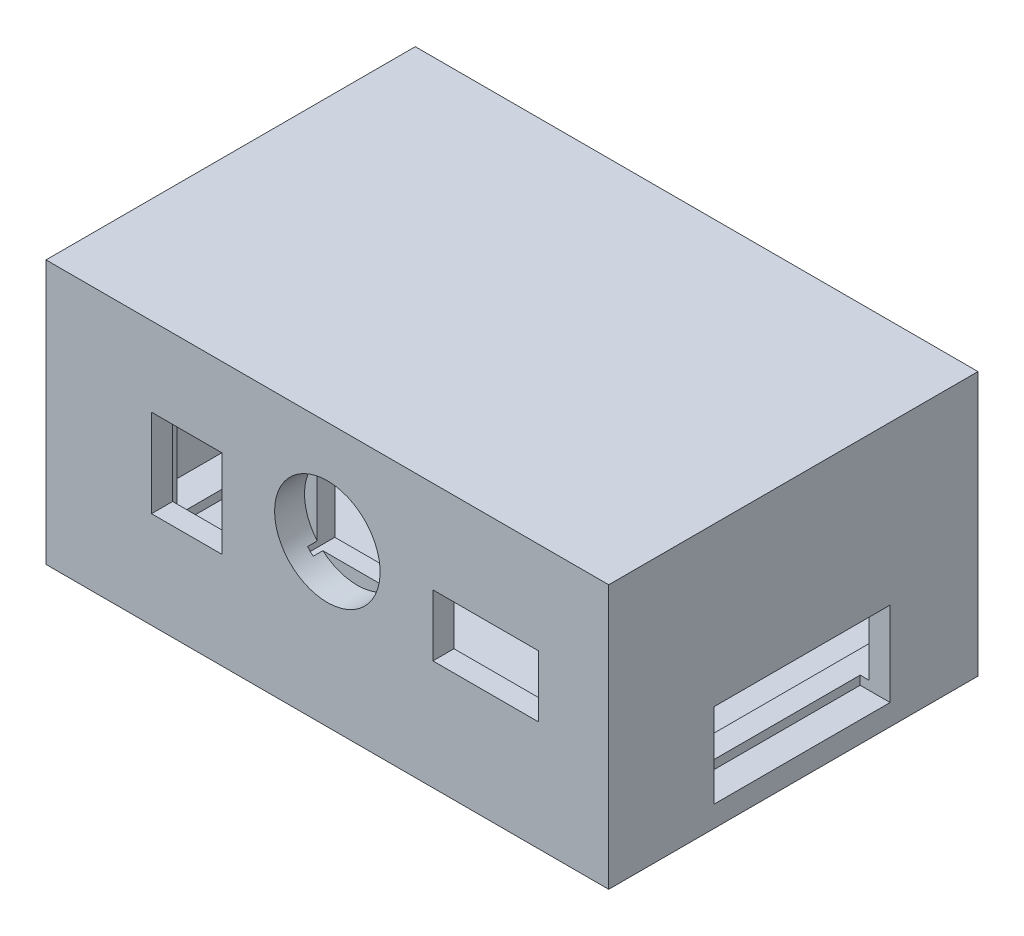
from build123d import *

# Parameters (mm, degrees)
BOSS_EXTRUDE1_START  = 80
SKETCH1_W            = 64
SKETCH1_H            = 30
BOSS_EXTRUDE1_DEPTH  = 42
BOSS_EXTRUDE2_START  = 79
SKETCH2_W            = 59.2
SKETCH2_H            = 25.2
BOSS_EXTRUDE2_DEPTH  = 40.6
BOSS_EXTRUDE3_START  = 80
SKETCH3_W            = 64
SKETCH3_H            = 10
BOSS_EXTRUDE3_DEPTH  = 2.4
BOSS_EXTRUDE4_START  = 80
SKETCH4_W            = 7.8
SKETCH4_H            = 11.6
BOSS_EXTRUDE4_DEPTH  = 6
BOSS_EXTRUDE5_START  = 79
SKETCH5_R            = 1
BOSS_EXTRUDE5_DEPTH  = 8
BOSS_EXTRUDE6_START  = 79
SKETCH6_R            = 1
BOSS_EXTRUDE6_DEPTH  = 8
BOSS_EXTRUDE7_START  = 80
SKETCH7_W            = 7.8
SKETCH7_H            = 11.6
BOSS_EXTRUDE7_DEPTH  = 6
BOSS_EXTRUDE8_START  = 79
SKETCH8_R            = 1
BOSS_EXTRUDE8_DEPTH  = 8
BOSS_EXTRUDE9_START  = 79
SKETCH9_R            = 1
BOSS_EXTRUDE9_DEPTH  = 8
BOSS_EXTRUDE10_START = 86
SKETCH10_W           = 3.6
SKETCH10_H           = 1
BOSS_EXTRUDE10_DEPTH = 28
BOSS_EXTRUDE11_START = 86
SKETCH11_W           = 3.6
SKETCH11_H           = 1
BOSS_EXTRUDE11_DEPTH = 28
BOSS_EXTRUDE12_START = 90
SKETCH12_W           = 4.4
SKETCH12_H           = 9.6
BOSS_EXTRUDE12_DEPTH = 20
BOSS_EXTRUDE13_START = 116.6
SKETCH13_W           = 13
SKETCH13_H           = 13
BOSS_EXTRUDE13_DEPTH = 3
BOSS_EXTRUDE14_START = 115.6
SKETCH14_W           = 9.1
SKETCH14_H           = 9.1
BOSS_EXTRUDE14_DEPTH = 4.1
BOSS_EXTRUDE15_START = 118.6
SKETCH15_R           = 6
BOSS_EXTRUDE15_DEPTH = 4.4
BOSS_EXTRUDE16_START = 117.1
SKETCH16_W           = 0.6
SKETCH16_H           = 16.4
BOSS_EXTRUDE16_DEPTH = 2.5
BOSS_EXTRUDE17_START = 117.1
SKETCH17_W           = 1.1
SKETCH17_H           = 16.4
BOSS_EXTRUDE17_DEPTH = 2.5
BOSS_EXTRUDE18_START = 118.6
SKETCH18_W           = 12
SKETCH18_H           = 7
BOSS_EXTRUDE18_DEPTH = 4.4
BOSS_EXTRUDE19_START = 117.1
SKETCH19_W           = 1.2
SKETCH19_H           = 25.2
BOSS_EXTRUDE19_DEPTH = 2.5
BOSS_EXTRUDE20_START = 117.1
SKETCH20_W           = 1.2
SKETCH20_H           = 25.2
BOSS_EXTRUDE20_DEPTH = 2.5
BOSS_EXTRUDE21_START = 118.6
SKETCH21_W           = 8
SKETCH21_H           = 10
BOSS_EXTRUDE21_DEPTH = 4.4


with BuildPart() as part:
    # Sketch1 → Boss-Extrude1 (new body)
    with BuildSketch(Plane.XY.offset(BOSS_EXTRUDE1_START)):
        with Locations((0, 65)):
            Rectangle(SKETCH1_W, SKETCH1_H)
    extrude(amount=BOSS_EXTRUDE1_DEPTH)


with BuildPart() as body_2:
    # Sketch2 → Boss-Extrude2 (new body)
    with BuildSketch(Plane.XY.offset(BOSS_EXTRUDE2_START)):
        with Locations((0, 65)):
            Rectangle(SKETCH2_W, SKETCH2_H)
    extrude(amount=BOSS_EXTRUDE2_DEPTH)


with BuildPart() as part_1:
    add(part.part)

    # Combine1: cut body 2
    add(body_2.part, mode=Mode.SUBTRACT)

    # Sketch3 → Boss-Extrude3 (add)
    with BuildSketch(Plane.XY.offset(BOSS_EXTRUDE3_START)):
        with Locations((0, 55)):
            Rectangle(SKETCH3_W, SKETCH3_H)
    extrude(amount=BOSS_EXTRUDE3_DEPTH)

    # Sketch4 → Boss-Extrude4 (add)
    with BuildSketch(Plane.XY.offset(BOSS_EXTRUDE4_START)):
        with Locations((-27.1, 67)):
            Rectangle(SKETCH4_W, SKETCH4_H)
    extrude(amount=BOSS_EXTRUDE4_DEPTH)


with BuildPart() as body_2_2:
    # Sketch5 → Boss-Extrude5 (new body)
    with BuildSketch(Plane.XY.offset(BOSS_EXTRUDE5_START)):
        with Locations((-26, 64)):
            Circle(SKETCH5_R)
    extrude(amount=BOSS_EXTRUDE5_DEPTH)


with BuildPart() as part_2:
    add(part_1.part)

    # Combine2: cut body 2 2
    add(body_2_2.part, mode=Mode.SUBTRACT)


with BuildPart() as body_2_3:
    # Sketch6 → Boss-Extrude6 (new body)
    with BuildSketch(Plane.XY.offset(BOSS_EXTRUDE6_START)):
        with Locations((-26, 70)):
            Circle(SKETCH6_R)
    extrude(amount=BOSS_EXTRUDE6_DEPTH)


with BuildPart() as part_3:
    add(part_2.part)

    # Combine3: cut body 2 3
    add(body_2_3.part, mode=Mode.SUBTRACT)

    # Sketch7 → Boss-Extrude7 (add)
    with BuildSketch(Plane.XY.offset(BOSS_EXTRUDE7_START)):
        with Locations((27.1, 67)):
            Rectangle(SKETCH7_W, SKETCH7_H)
    extrude(amount=BOSS_EXTRUDE7_DEPTH)


with BuildPart() as body_2_4:
    # Sketch8 → Boss-Extrude8 (new body)
    with BuildSketch(Plane.XY.offset(BOSS_EXTRUDE8_START)):
        with Locations((26, 64)):
            Circle(SKETCH8_R)
    extrude(amount=BOSS_EXTRUDE8_DEPTH)


with BuildPart() as part_4:
    add(part_3.part)

    # Combine4: cut body 2 4
    add(body_2_4.part, mode=Mode.SUBTRACT)


with BuildPart() as body_2_5:
    # Sketch9 → Boss-Extrude9 (new body)
    with BuildSketch(Plane.XY.offset(BOSS_EXTRUDE9_START)):
        with Locations((26, 70)):
            Circle(SKETCH9_R)
    extrude(amount=BOSS_EXTRUDE9_DEPTH)


with BuildPart() as part_5:
    add(part_4.part)

    # Combine5: cut body 2 5
    add(body_2_5.part, mode=Mode.SUBTRACT)

    # Sketch10 → Boss-Extrude10 (add)
    with BuildSketch(Plane.XY.offset(BOSS_EXTRUDE10_START)):
        with Locations((-27.8, 52.9)):
            Rectangle(SKETCH10_W, SKETCH10_H)
    extrude(amount=BOSS_EXTRUDE10_DEPTH)

    # Sketch11 → Boss-Extrude11 (add)
    with BuildSketch(Plane.XY.offset(BOSS_EXTRUDE11_START)):
        with Locations((27.8, 52.9)):
            Rectangle(SKETCH11_W, SKETCH11_H)
    extrude(amount=BOSS_EXTRUDE11_DEPTH)


with BuildPart() as body_2_6:
    # Sketch12 → Boss-Extrude12 (new body)
    with BuildSketch(Plane.XY.offset(BOSS_EXTRUDE12_START)):
        with Locations((30.8, 57.2)):
            Rectangle(SKETCH12_W, SKETCH12_H)
    extrude(amount=BOSS_EXTRUDE12_DEPTH)


with BuildPart() as part_6:
    add(part_5.part)

    # Combine6: cut body 2 6
    add(body_2_6.part, mode=Mode.SUBTRACT)

    # Sketch13 → Boss-Extrude13 (add)
    with BuildSketch(Plane.XY.offset(BOSS_EXTRUDE13_START)):
        with Locations((0, 68.25)):
            Rectangle(SKETCH13_W, SKETCH13_H)
    extrude(amount=BOSS_EXTRUDE13_DEPTH)


with BuildPart() as body_2_7:
    # Sketch14 → Boss-Extrude14 (new body)
    with BuildSketch(Plane.XY.offset(BOSS_EXTRUDE14_START)):
        with Locations((0, 68.25)):
            Rectangle(SKETCH14_W, SKETCH14_H)
    extrude(amount=BOSS_EXTRUDE14_DEPTH)


with BuildPart() as part_7:
    add(part_6.part)

    # Combine7: cut body 2 7
    add(body_2_7.part, mode=Mode.SUBTRACT)


with BuildPart() as body_2_8:
    # Sketch15 → Boss-Extrude15 (new body)
    with BuildSketch(Plane.XY.offset(BOSS_EXTRUDE15_START)):
        with Locations((0, 68.25)):
            Circle(SKETCH15_R)
    extrude(amount=BOSS_EXTRUDE15_DEPTH)


with BuildPart() as part_8:
    add(part_7.part)

    # Combine8: cut body 2 8
    add(body_2_8.part, mode=Mode.SUBTRACT)

    # Sketch16 → Boss-Extrude16 (add)
    with BuildSketch(Plane.XY.offset(BOSS_EXTRUDE16_START)):
        with Locations((7.7, 66)):
            Rectangle(SKETCH16_W, SKETCH16_H)
    extrude(amount=BOSS_EXTRUDE16_DEPTH)

    # Sketch17 → Boss-Extrude17 (add)
    with BuildSketch(Plane.XY.offset(BOSS_EXTRUDE17_START)):
        with Locations((29.05, 66)):
            Rectangle(SKETCH17_W, SKETCH17_H)
    extrude(amount=BOSS_EXTRUDE17_DEPTH)


with BuildPart() as body_2_9:
    # Sketch18 → Boss-Extrude18 (new body)
    with BuildSketch(Plane.XY.offset(BOSS_EXTRUDE18_START)):
        with Locations((18, 66)):
            Rectangle(SKETCH18_W, SKETCH18_H)
    extrude(amount=BOSS_EXTRUDE18_DEPTH)


with BuildPart() as part_9:
    add(part_8.part)

    # Combine9: cut body 2 9
    add(body_2_9.part, mode=Mode.SUBTRACT)

    # Sketch19 → Boss-Extrude19 (add)
    with BuildSketch(Plane.XY.offset(BOSS_EXTRUDE19_START)):
        with Locations((-22.6, 65)):
            Rectangle(SKETCH19_W, SKETCH19_H)
    extrude(amount=BOSS_EXTRUDE19_DEPTH)

    # Sketch20 → Boss-Extrude20 (add)
    with BuildSketch(Plane.XY.offset(BOSS_EXTRUDE20_START)):
        with Locations((-9.4, 65)):
            Rectangle(SKETCH20_W, SKETCH20_H)
    extrude(amount=BOSS_EXTRUDE20_DEPTH)


with BuildPart() as body_2_10:
    # Sketch21 → Boss-Extrude21 (new body)
    with BuildSketch(Plane.XY.offset(BOSS_EXTRUDE21_START)):
        with Locations((-16, 66)):
            Rectangle(SKETCH21_W, SKETCH21_H)
    extrude(amount=BOSS_EXTRUDE21_DEPTH)


with BuildPart() as part_10:
    add(part_9.part)

    # Combine10: cut body 2 10
    add(body_2_10.part, mode=Mode.SUBTRACT)


solid = part_10.part
